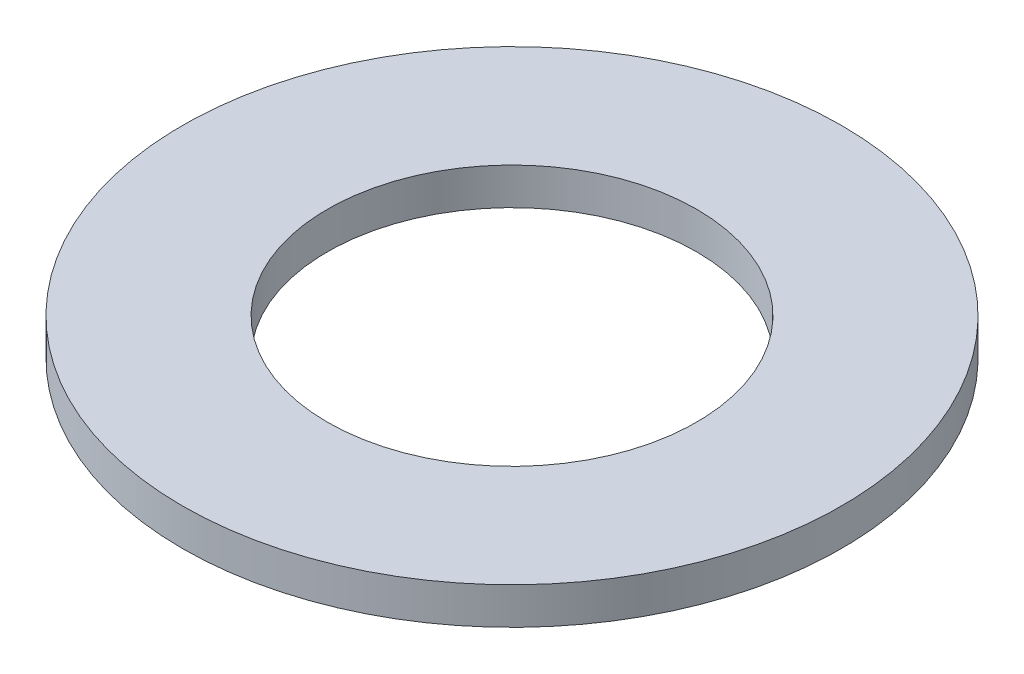
from build123d import *

# Parameters (mm, degrees)
SKETCH1_R           = 62.5
BOSS_EXTRUDE1_DEPTH = 7
SKETCH2_R           = 35
CUT_EXTRUDE1_DEPTH  = 89.665100237


with BuildPart() as part:
    # Sketch1 → Boss-Extrude1 (new body)
    with BuildSketch(Plane(origin=(0, 0, 0), x_dir=(1, 0, 0), z_dir=(0, 1, 0))):
        Circle(SKETCH1_R)
    extrude(amount=BOSS_EXTRUDE1_DEPTH)

    # Sketch2 → Cut-Extrude1 (cut, through all)
    with BuildSketch(Plane(origin=(0, 0, 0), x_dir=(1, 0, 0), z_dir=(0, 1, 0))):
        Circle(SKETCH2_R)
    extrude(amount=CUT_EXTRUDE1_DEPTH, mode=Mode.SUBTRACT)


solid = part.part
